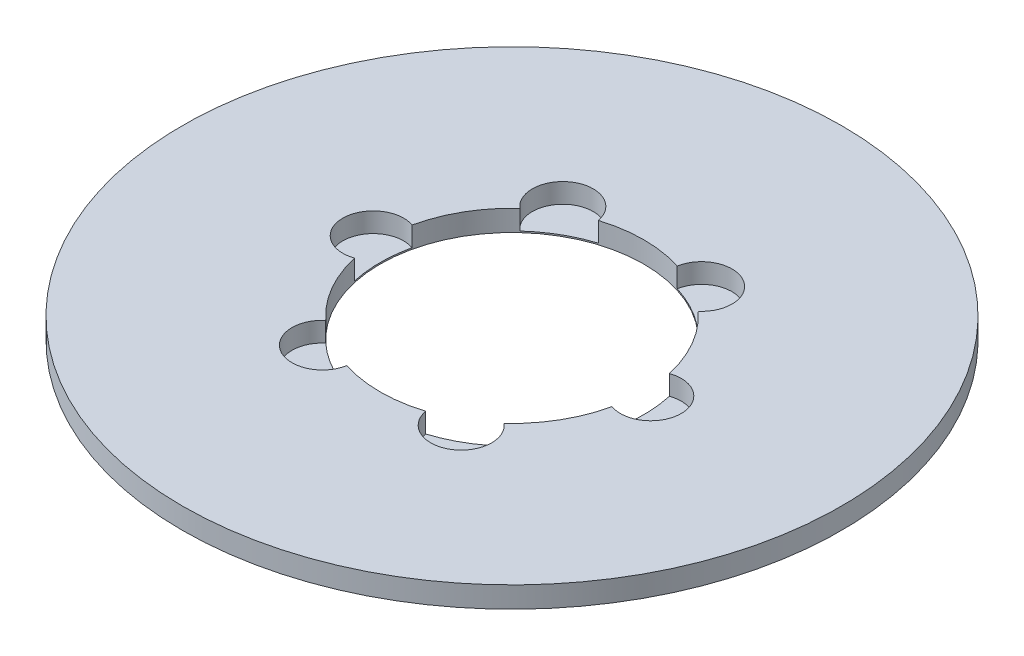
from build123d import *

# Parameters (mm, degrees)
SKETCH1_R           = 62.5
BOSS_EXTRUDE1_DEPTH = 4
SKETCH2_R           = 25
CUT_EXTRUDE1_DEPTH  = 89.478811023
SKETCH3_R           = 5.775575554
CUT_EXTRUDE2_DEPTH  = 3.73522955
CIRPATTERN1_COUNT   = 6


with BuildPart() as part:
    # Sketch1 → Boss-Extrude1 (new body)
    with BuildSketch(Plane(origin=(0, 0, 0), x_dir=(1, 0, 0), z_dir=(0, 1, 0))):
        Circle(SKETCH1_R)
    extrude(amount=BOSS_EXTRUDE1_DEPTH)

    # Sketch2 → Cut-Extrude1 (cut, through all)
    with BuildSketch(Plane(origin=(0, 0, 0), x_dir=(1, 0, 0), z_dir=(0, 1, 0))):
        Circle(SKETCH2_R)
    extrude(amount=CUT_EXTRUDE1_DEPTH, mode=Mode.SUBTRACT)

    # Sketch3 → Cut-Extrude2 (cut)
    with BuildSketch(Plane(origin=(0, 4, 0), x_dir=(1, 0, 0), z_dir=(0, 1, 0))):
        with Locations((-26.317800491, 0)):
            Circle(SKETCH3_R)
    cut_extrude2 = extrude(amount=-CUT_EXTRUDE2_DEPTH, mode=Mode.SUBTRACT)

    # CirPattern1: Cut-Extrude2 ×6 about axis
    cirpattern1_axis = Axis((0, 0, 0), (0, 1, 0))
    for i in range(1, CIRPATTERN1_COUNT):
        add(cut_extrude2.rotate(cirpattern1_axis, i * 360 / CIRPATTERN1_COUNT), mode=Mode.SUBTRACT)


solid = part.part
